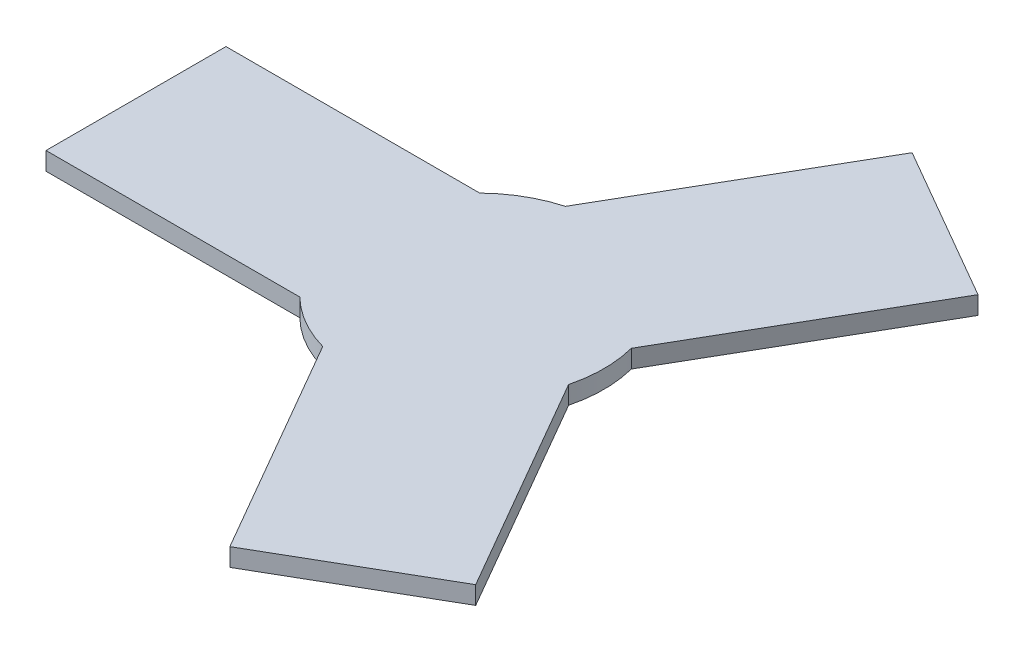
from build123d import *

# Parameters (mm, degrees)
BOSS_EXTRU_3_DEPTH = 5


with BuildPart() as part:
    # Esquisse3 → Boss.-Extru.3 (new body)
    with BuildSketch(Plane(origin=(0, 0, 0), x_dir=(1, 0, 0), z_dir=(0, 1, 0))):
        with BuildLine():
            Line((33.898083809, 8.713203436), (69.150635095, 69.77241336))
            Line((69.150635095, 69.77241336), (25.849364905, 94.77241336))
            Line((25.849364905, 94.77241336), (-9.403186381, 33.713203436))
            ThreePointArc((-9.403186381, 33.713203436), (-17.5, 30.310889132), (-24.494897428, 25))
            Line((-24.494897428, 25), (-95, 25))
            Line((-95, 25), (-95, -25))
            Line((-95, -25), (-24.494897428, -25))
            ThreePointArc((-24.494897428, -25), (-17.5, -30.310889132), (-9.403186381, -33.713203436))
            Line((-9.403186381, -33.713203436), (25.849364905, -94.77241336))
            Line((25.849364905, -94.77241336), (69.150635095, -69.77241336))
            Line((69.150635095, -69.77241336), (33.898083809, -8.713203436))
            ThreePointArc((33.898083809, -8.713203436), (35, 0), (33.898083809, 8.713203436))
        make_face()
    extrude(amount=BOSS_EXTRU_3_DEPTH)


solid = part.part
